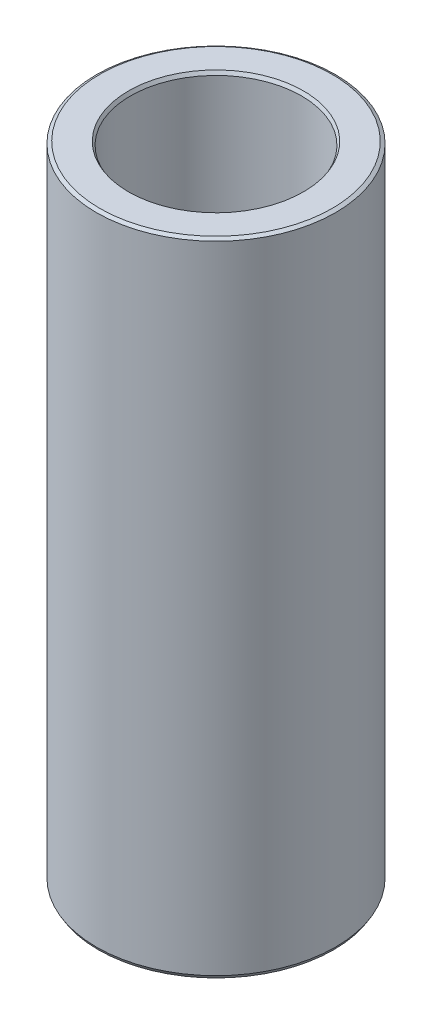
from build123d import *
from OCP.BRepFilletAPI import BRepFilletAPI_MakeChamfer

# Parameters (mm, degrees)
SKETCH1_R           = 32.5
BOSS_EXTRUDE1_DEPTH = 174.338042168
SKETCH2_R           = 23.256764299
CUT_EXTRUDE1_DEPTH  = 181.294905494
CHAMFER1_SIZE       = 0.531086097
CHAMFER1_SIZE2      = 0.919868104


with BuildPart() as part:
    # Sketch1 → Boss-Extrude1 (new body)
    with BuildSketch(Plane(origin=(0, 0, 0), x_dir=(1, 0, 0), z_dir=(0, 1, 0))):
        Circle(SKETCH1_R)
    extrude(amount=BOSS_EXTRUDE1_DEPTH)

    # Sketch2 → Cut-Extrude1 (cut, through all)
    with BuildSketch(Plane(origin=(0, 0, 0), x_dir=(1, 0, 0), z_dir=(0, 1, 0))):
        Circle(SKETCH2_R)
    extrude(amount=CUT_EXTRUDE1_DEPTH, mode=Mode.SUBTRACT)

    # Chamfer1: one chamfer whose edges measure the first distance from different faces: ONE call of the kernel's chamfer builder (chamfer() names one face for all edges)
    chamfer1_edges_1 = [part.edges().sort_by_distance(p)[0] for p in [
        (-23.256764299, 174.338042168, 0),
    ]]
    chamfer1_side_1 = [part.faces().sort_by_distance(p)[0] for p in [
        (-31.580761184, 174.338042168, 0),
    ]]
    chamfer1_edges_2 = [part.edges().sort_by_distance(p)[0] for p in [
        (-23.256764299, 0, 0),
    ]]
    chamfer1_side_2 = [part.faces().sort_by_distance(p)[0] for p in [
        (-23.256764299, 87.169021084, 0),
    ]]
    chamfer1_edges_3 = [part.edges().sort_by_distance(p)[0] for p in [
        (-32.5, 0, 0),
    ]]
    chamfer1_side_3 = [part.faces().sort_by_distance(p)[0] for p in [
        (-31.580761184, 0, 0),
    ]]
    chamfer1_edges_4 = [part.edges().sort_by_distance(p)[0] for p in [
        (-32.5, 174.338042168, 0),
    ]]
    chamfer1_side_4 = [part.faces().sort_by_distance(p)[0] for p in [
        (-32.5, 87.169021084, 0),
    ]]
    chamfer1 = BRepFilletAPI_MakeChamfer(part.part.solid().wrapped)
    for e in chamfer1_edges_1:
        chamfer1.Add(CHAMFER1_SIZE, CHAMFER1_SIZE2, e.wrapped, chamfer1_side_1[0].wrapped)  # the first distance lies on this face
    for e in chamfer1_edges_2:
        chamfer1.Add(CHAMFER1_SIZE, CHAMFER1_SIZE2, e.wrapped, chamfer1_side_2[0].wrapped)  # the first distance lies on this face
    for e in chamfer1_edges_3:
        chamfer1.Add(CHAMFER1_SIZE, CHAMFER1_SIZE2, e.wrapped, chamfer1_side_3[0].wrapped)  # the first distance lies on this face
    for e in chamfer1_edges_4:
        chamfer1.Add(CHAMFER1_SIZE, CHAMFER1_SIZE2, e.wrapped, chamfer1_side_4[0].wrapped)  # the first distance lies on this face
    add(Compound.cast(chamfer1.Shape()), mode=Mode.REPLACE)


solid = part.part
